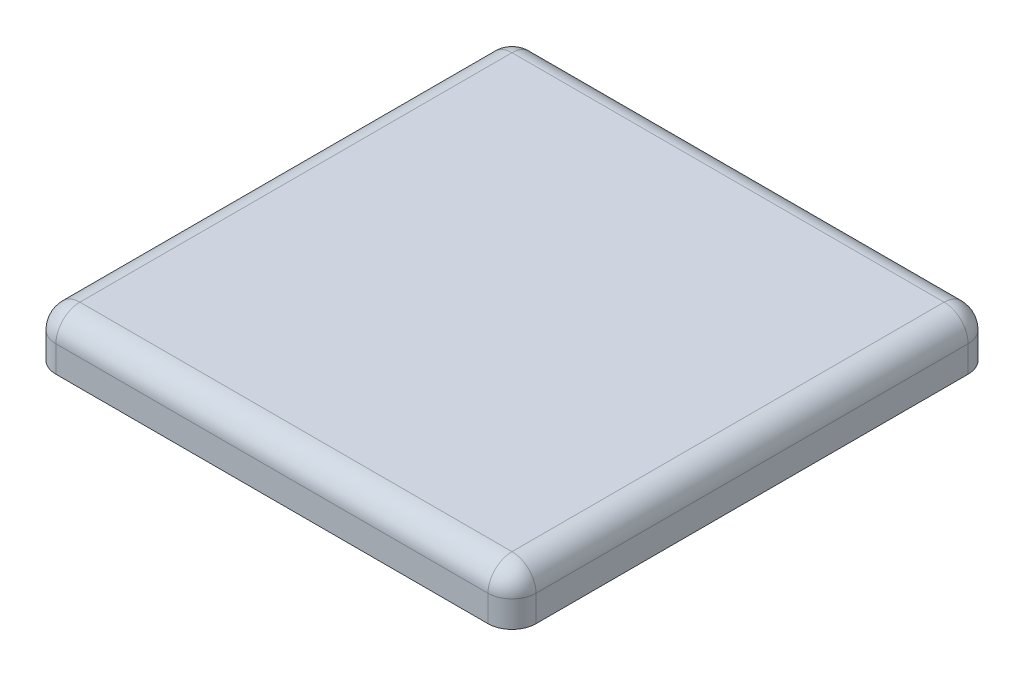
from build123d import *

# Parameters (mm, degrees)
AUFSATZ_LINEAR_AUSTRAGEN1_DEPTH = 4.2
VERRUNDUNG1_R                   = 2
SKIZZE2_R                       = 3.5
AUFSATZ_LINEAR_AUSTRAGEN2_DEPTH = 10
FASE1_SIZE                      = 3
FASE1_SIZE2                     = 1.091910703


with BuildPart() as part:
    # Skizze1 → Aufsatz-Linear austragen1 (new body)
    with BuildSketch(Plane(origin=(0, 0, 0), x_dir=(1, 0, 0), z_dir=(0, 1, 0))):
        with BuildLine():
            Line((-20, -18), (-20, 18))
            ThreePointArc((-20, 18), (-19.414213562, 19.414213562), (-18, 20))
            Line((-18, 20), (18, 20))
            ThreePointArc((18, 20), (19.414213562, 19.414213562), (20, 18))
            Line((20, 18), (20, -18))
            ThreePointArc((20, -18), (19.414213562, -19.414213562), (18, -20))
            Line((18, -20), (-18, -20))
            ThreePointArc((-18, -20), (-19.414213562, -19.414213562), (-20, -18))
        make_face()
    extrude(amount=AUFSATZ_LINEAR_AUSTRAGEN1_DEPTH)

    # Verrundung1
    verrundung1_edges = [part.edges().sort_by_distance(p)[0] for p in [
        (19.414213562, 4.2, 19.414213562),
        (0, 4.2, 20),
        (-19.414213562, 4.2, 19.414213562),
        (-20, 4.2, 0),
        (-19.414213562, 4.2, -19.414213562),
        (0, 4.2, -20),
        (19.414213562, 4.2, -19.414213562),
        (20, 4.2, 0),
    ]]
    fillet(verrundung1_edges, radius=VERRUNDUNG1_R)

    # Skizze2 → Aufsatz-Linear austragen2 (add)
    with BuildSketch(Plane.XZ):
        Circle(SKIZZE2_R)
    extrude(amount=AUFSATZ_LINEAR_AUSTRAGEN2_DEPTH)

    # Fase1
    fase1_edges = [part.edges().sort_by_distance(p)[0] for p in [
        (-3.5, -10, 0),
    ]]
    fase1_side = [part.faces().sort_by_distance(p)[0] for p in [
        (-3.5, -5, 0),
    ]]
    chamfer(fase1_edges, length=FASE1_SIZE, length2=FASE1_SIZE2, reference=fase1_side[0])


solid = part.part
